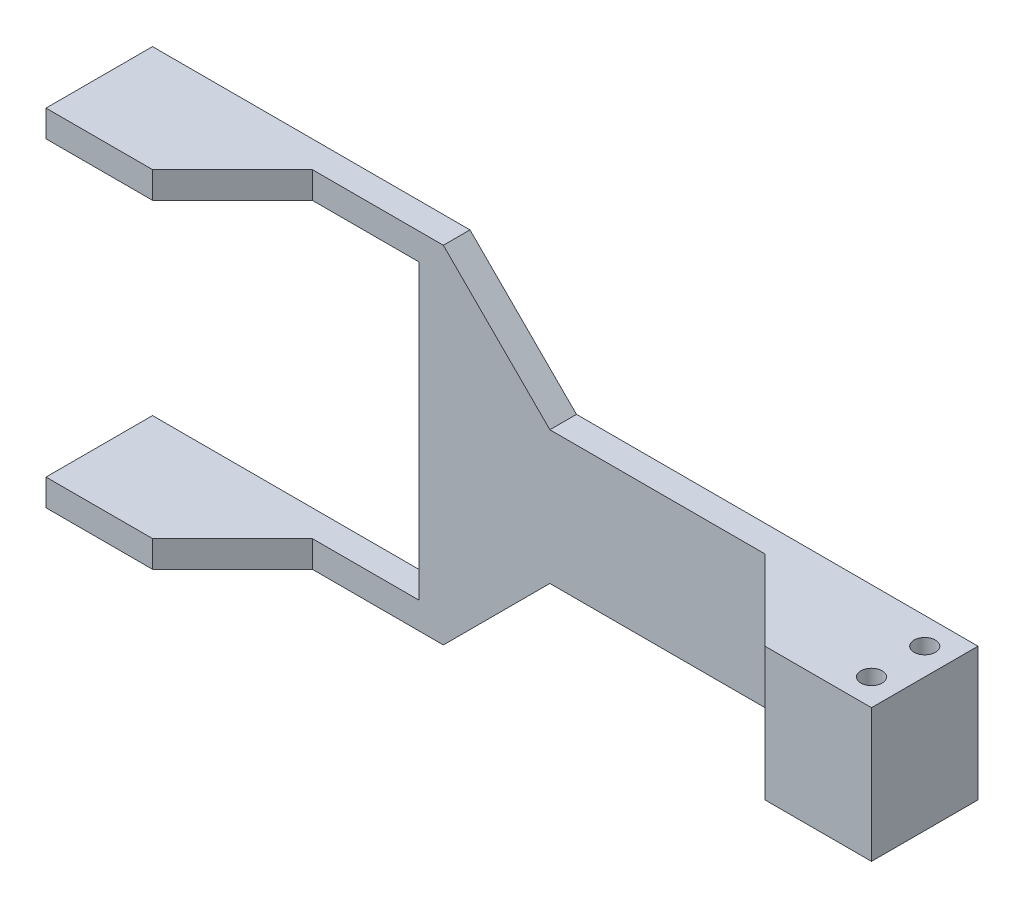
from build123d import *

# Parameters (mm, degrees)
EXTRUSION1_DEPTH        = 20
ESQUISSE2_R             = 2
ENL_V_MAT_EXTRU_1_DEPTH = 112.467484048
ENL_V_MAT_EXTRU_2_DEPTH = 121.933866224


with BuildPart() as part:
    # Esquisse1 → Extrusion1 (new body)
    with BuildSketch(Plane.XY):
        Polygon((-55, 32.5), (-55, 27.5), (0, 27.5), (0, -27.5), (-55, -27.5), (-55, -32.5), (4.609964413, -32.5), (24.609964413, -12.5), (100, -12.5), (100, 12.5), (24.609964413, 12.5), (4.609964413, 32.5), align=None)
    extrude(amount=EXTRUSION1_DEPTH)

    # Esquisse2 → Enlèv. mat.-Extru.1 (cut, through all)
    with BuildSketch(Plane.XZ.offset(12.5)):
        with Locations((95, 15)):
            Circle(ESQUISSE2_R)
        with Locations((95, 5)):
            Circle(ESQUISSE2_R)
    extrude(amount=-ENL_V_MAT_EXTRU_1_DEPTH, mode=Mode.SUBTRACT)

    # Esquisse3 → Enlèv. mat.-Extru.2 (cut, through all)
    with BuildSketch(Plane.XZ.offset(32.5)):
        Polygon((-35, 20), (-20, 5), (65, 5), (80, 20), align=None)
    extrude(amount=-ENL_V_MAT_EXTRU_2_DEPTH, mode=Mode.SUBTRACT)


solid = part.part
